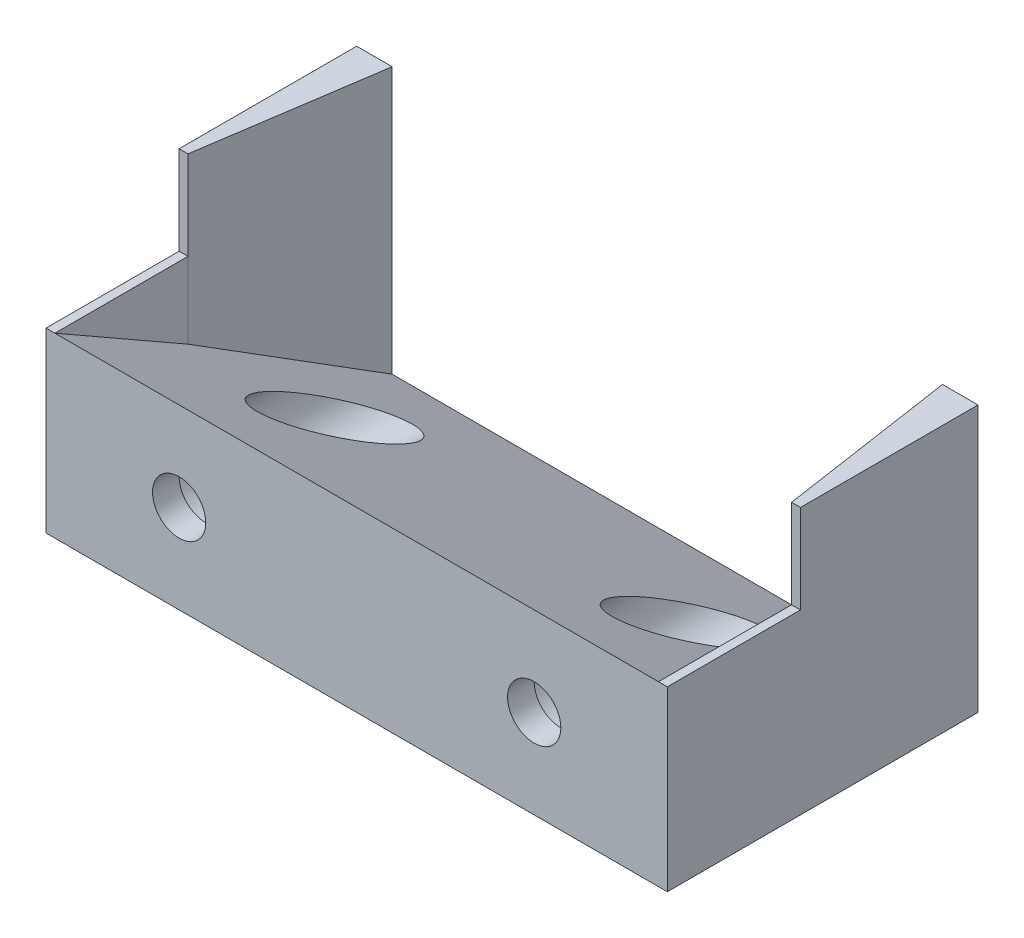
from build123d import *

# Parameters (mm, degrees)
EXTRUDE_2_DEPTH     = 35
SKETCH_4_W          = 70
SKETCH_4_H          = 20
EXTRUDE_3_DEPTH     = 15
SKETCH_6_W          = 2
SKETCH_6_H          = 20
EXTRUDE_5_DEPTH     = 30
SKETCH_8_R          = 3
CUT_EXTRUDE_3_DEPTH = 54.38539126
SKETCH_9_R          = 5
CUT_EXTRUDE_4_DEPTH = 50
CUT_EXTRUDE_7_DEPTH = 66
SKETCH_11_W         = 70
SKETCH_11_H         = 15
SKETCH_11_R         = 3
EXTRUDE_7_DEPTH     = 3
CUT_EXTRUDE_8_DEPTH = 1
CUT_EXTRUDE_9_DEPTH = 1
EXTRUDE_9_DEPTH     = 30


with BuildPart() as part:
    # 草图1 → 凸台-拉伸2 (new, symmetric)
    with BuildSketch(Plane(origin=(0, 0, 0), x_dir=(0, 0, -1), z_dir=(1, 0, 0))):
        Polygon((0, 0), (0, -20), (20, -20), align=None)
    extrude(amount=EXTRUDE_2_DEPTH, both=True)

    # 草图4 → 凸台-拉伸3 (add)
    with BuildSketch(Plane.XY):
        with Locations((0, -10)):
            Rectangle(SKETCH_4_W, SKETCH_4_H)
    extrude(amount=EXTRUDE_3_DEPTH)

    # 草图6 → 凸台-拉伸5 (add)
    with BuildSketch(Plane.XZ.offset(20)):
        with Locations((-34, -10)):
            Rectangle(SKETCH_6_W, SKETCH_6_H)
        with Locations((34, -10)):
            Rectangle(SKETCH_6_W, SKETCH_6_H)
    extrude(amount=-EXTRUDE_5_DEPTH)

    # 草图8 → 切除-拉伸3 (cut, through all)
    with BuildSketch(Plane.XY.offset(15)):
        with Locations((-20, -10)):
            Circle(SKETCH_8_R)
        with Locations((20, -10)):
            Circle(SKETCH_8_R)
    extrude(amount=-CUT_EXTRUDE_3_DEPTH, mode=Mode.SUBTRACT)

    # 草图9 → 切除-拉伸4 (cut)
    with BuildSketch(Plane(origin=(0, 0, -20), x_dir=(-1, 0, 0), z_dir=(0, 0, -1))):
        with Locations((-20, -10)):
            Circle(SKETCH_9_R)
        with Locations((20, -10)):
            Circle(SKETCH_9_R)
    extrude(amount=-CUT_EXTRUDE_4_DEPTH, mode=Mode.SUBTRACT)

    # 草图10 → 切除-拉伸7 (cut)
    with BuildSketch(Plane(origin=(-33, 0, 0), x_dir=(0, 0, -1), z_dir=(1, 0, 0))):
        Polygon((-15, 0), (20, -20), (20, 0), align=None)
    extrude(amount=CUT_EXTRUDE_7_DEPTH, mode=Mode.SUBTRACT)

    # 草图11 → 凸台-拉伸7 (add)
    with BuildSketch(Plane.XY.offset(15)):
        with Locations((0, -12.5)):
            Rectangle(SKETCH_11_W, SKETCH_11_H)
        with Locations((-20, -10)):
            Circle(SKETCH_11_R, mode=Mode.SUBTRACT)
        with Locations((20, -10)):
            Circle(SKETCH_11_R, mode=Mode.SUBTRACT)
    extrude(amount=-EXTRUDE_7_DEPTH)

    # 草图12 → 切除-拉伸8 (cut)
    with BuildSketch(Plane.ZY.offset(-33)):
        Polygon((-20, 10), (0, 10), (0, 0), (15, 0), (-20, -20), align=None)
    extrude(amount=-CUT_EXTRUDE_8_DEPTH, mode=Mode.SUBTRACT)

    # 草图13 → 切除-拉伸9 (cut)
    with BuildSketch(Plane(origin=(-33, 0, 0), x_dir=(0, 0, -1), z_dir=(1, 0, 0))):
        Polygon((-15, 0), (20, -20), (20, 10), (0, 10), (0, 0), align=None)
    extrude(amount=-CUT_EXTRUDE_9_DEPTH, mode=Mode.SUBTRACT)

    # 草图14 → 凸台-拉伸9 (add)
    with BuildSketch(Plane.XZ.offset(20)):
        Polygon((-34, -20), (-31, -20), (-34, 0), align=None)
        Polygon((34, -20), (31, -20), (34, 0), align=None)
    extrude(amount=-EXTRUDE_9_DEPTH)


solid = part.part
